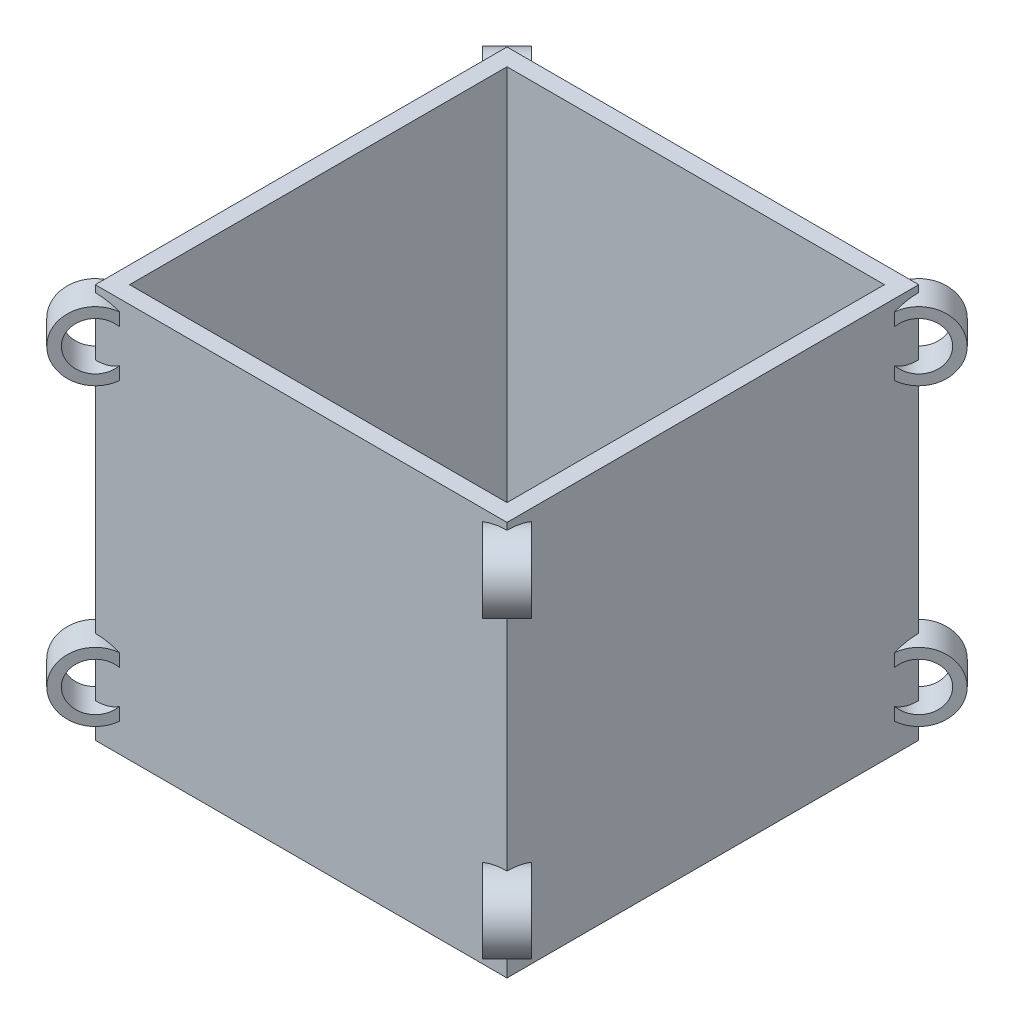
from build123d import *

# Parameters (mm, degrees)
SKETCH1_W                = 120
SKETCH1_H                = 120
BOSS_EXTRUDE1_DEPTH      = 115
SHELL1_T                 = -5
BOSS_EXTRUDE2_DEPTH      = 5
BOSS_EXTRUDE2_DEPTH_BACK = 5
BOSS_EXTRUDE3_DEPTH      = 5
BOSS_EXTRUDE3_DEPTH_BACK = 5


with BuildPart() as part:
    # Sketch1 → Boss-Extrude1 (new body)
    with BuildSketch(Plane(origin=(0, 0, 0), x_dir=(1, 0, 0), z_dir=(0, 1, 0))):
        Rectangle(SKETCH1_W, SKETCH1_H)
    extrude(amount=BOSS_EXTRUDE1_DEPTH)

    # Shell1
    shell1_openings = [part.faces().sort_by_distance(p)[0] for p in [
        (0, 115, 0),
    ]]
    offset(amount=SHELL1_T, openings=shell1_openings, kind=Kind.INTERSECTION)

    # Sketch2 → Boss-Extrude2 (add, two sides: drawn at the far end of the back side and taken through both)
    with BuildSketch(Plane(origin=(0, 0, 0), x_dir=(0.7071067811865475, 0, 0.7071067811865477), z_dir=(-0.7071067811865477, 0, 0.7071067811865475)).offset(-BOSS_EXTRUDE2_DEPTH_BACK)):
        with BuildLine():
            Line((-78.852813742, 20.605551275), (-78.852813742, 25))
            ThreePointArc((-78.852813742, 25), (-94.852813742, 17), (-78.852813742, 9))
            Line((-78.852813742, 9), (-78.852813742, 13.394448725))
            ThreePointArc((-78.852813742, 13.394448725), (-91.852813742, 17), (-78.852813742, 20.605551275))
        make_face()
        with BuildLine():
            Line((-78.852813742, 106.605551275), (-78.852813742, 111))
            ThreePointArc((-78.852813742, 111), (-94.852813742, 103), (-78.852813742, 95))
            Line((-78.852813742, 95), (-78.852813742, 99.394448725))
            ThreePointArc((-78.852813742, 99.394448725), (-91.852813742, 103), (-78.852813742, 106.605551275))
        make_face()
        with BuildLine():
            ThreePointArc((78.852813742, 95), (94.852813742, 103), (78.852813742, 111))
            Line((78.852813742, 111), (78.852813742, 106.605551275))
            ThreePointArc((78.852813742, 106.605551275), (91.852813742, 103), (78.852813742, 99.394448725))
            Line((78.852813742, 99.394448725), (78.852813742, 95))
        make_face()
        with BuildLine():
            ThreePointArc((78.852813742, 9), (94.852813742, 17), (78.852813742, 25))
            Line((78.852813742, 25), (78.852813742, 20.605551275))
            ThreePointArc((78.852813742, 20.605551275), (91.852813742, 17), (78.852813742, 13.394448725))
            Line((78.852813742, 13.394448725), (78.852813742, 9))
        make_face()
    extrude(amount=BOSS_EXTRUDE2_DEPTH + BOSS_EXTRUDE2_DEPTH_BACK)

    # Sketch3 → Boss-Extrude3 (add, two sides: drawn at the far end of the back side and taken through both)
    with BuildSketch(Plane(origin=(0, 0, 0), x_dir=(0.7071067811865475, 0, -0.7071067811865476), z_dir=(0.7071067811865476, 0, 0.7071067811865475)).offset(-BOSS_EXTRUDE3_DEPTH_BACK)):
        with BuildLine():
            Line((-78.852813742, 111), (-78.852813742, 106.605551275))
            ThreePointArc((-78.852813742, 106.605551275), (-91.852813742, 103), (-78.852813742, 99.394448725))
            Line((-78.852813742, 99.394448725), (-78.852813742, 95))
            ThreePointArc((-78.852813742, 95), (-94.852813742, 103), (-78.852813742, 111))
        make_face()
        with BuildLine():
            Line((78.852813742, 111), (78.852813742, 106.605551275))
            ThreePointArc((78.852813742, 106.605551275), (91.852813742, 103), (78.852813742, 99.394448725))
            Line((78.852813742, 99.394448725), (78.852813742, 95))
            ThreePointArc((78.852813742, 95), (94.852813742, 103), (78.852813742, 111))
        make_face()
        with BuildLine():
            Line((-78.852813742, 13.394448725), (-78.852813742, 9))
            ThreePointArc((-78.852813742, 9), (-94.852813742, 17), (-78.852813742, 25))
            Line((-78.852813742, 25), (-78.852813742, 20.605551275))
            ThreePointArc((-78.852813742, 20.605551275), (-91.852813742, 17), (-78.852813742, 13.394448725))
        make_face()
        with BuildLine():
            Line((78.852813742, 25), (78.852813742, 20.605551275))
            ThreePointArc((78.852813742, 20.605551275), (91.852813742, 17), (78.852813742, 13.394448725))
            Line((78.852813742, 13.394448725), (78.852813742, 9))
            ThreePointArc((78.852813742, 9), (94.852813742, 17), (78.852813742, 25))
        make_face()
    extrude(amount=BOSS_EXTRUDE3_DEPTH + BOSS_EXTRUDE3_DEPTH_BACK)


solid = part.part
